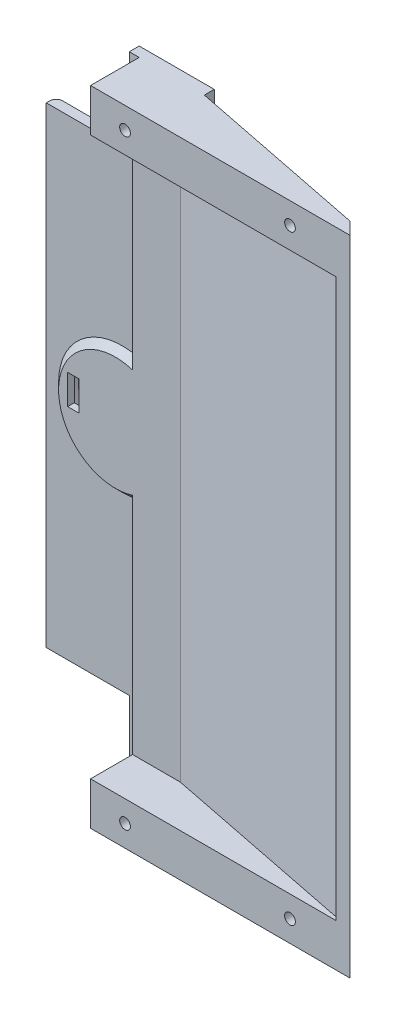
from build123d import *

# Parameters (mm, degrees)
CROQUIS1_W                 = 78.58
CROQUIS1_H                 = 17.74
SALIENTE_EXTRUIR1_DEPTH    = 195
CORTAR_EXTRUIR1_DEPTH      = 200.116501074
CORTAR_EXTRUIR1_DEPTH_BACK = 200.116501074
CHAFL_N1_SIZE2             = 3.821967962
CHAFL_N1_SIZE              = 3
CROQUIS4_W                 = 3
CROQUIS4_H                 = 195
SALIENTE_EXTRUIR2_DEPTH    = 3
CROQUIS5_W                 = 25.18
CROQUIS5_H                 = 143
SALIENTE_EXTRUIR3_DEPTH    = 3
REDONDEO1_R                = 2
CORTAR_EXTRUIR2_DEPTH      = 208.103617786
CORTAR_EXTRUIR2_DEPTH_BACK = 208.103617786
CROQUIS6_R                 = 1.625
CORTAR_EXTRUIR3_START      = -3
CROQUIS7_R                 = 3.5
CORTAR_EXTRUIR3_DEPTH      = 205.103617786
CROQUIS8_R                 = 16.25
CROQUIS8_R_2               = 8.75
CORTAR_EXTRUIR4_DEPTH      = 3
CROQUIS9_R                 = 17.25
SALIENTE_EXTRUIR4_DEPTH    = 2
CHAFL_N2_SIZE              = 2
CORTAR_EXTRUIR6_DEPTH      = 208.103617786
CORTAR_EXTRUIR6_DEPTH_BACK = 208.103617786
CROQUIS10_W                = 3.5
CROQUIS10_H                = 9
CORTAR_EXTRUIR7_DEPTH      = 1
CORTAR_EXTRUIR8_START      = -13
CORTAR_EXTRUIR8_DEPTH      = 169


with BuildPart() as part:
    # Croquis1 → Saliente-Extruir1 (new body)
    with BuildSketch(Plane(origin=(0, 0, 0), x_dir=(1, 0, 0), z_dir=(0, 1, 0))):
        Rectangle(CROQUIS1_W, CROQUIS1_H)
    extrude(amount=SALIENTE_EXTRUIR1_DEPTH)

    # Croquis2 → Cortar-Extruir1 (cut, two sides: drawn at the far end of the back side and taken through both)
    with BuildSketch(Plane.XZ.offset(-CORTAR_EXTRUIR1_DEPTH_BACK)):
        Polygon((39.29, 5.87), (-19.532543769, -5.87), (-19.532543769, -8.87), (39.29, -8.87), align=None)
    extrude(amount=CORTAR_EXTRUIR1_DEPTH + CORTAR_EXTRUIR1_DEPTH_BACK, mode=Mode.SUBTRACT)

    # Chaflán1
    chafl_n1_edges = [part.edges().sort_by_distance(p)[0] for p in [
        (39.29, 97.5, 5.87),
    ]]
    chafl_n1_side = [part.faces().sort_by_distance(p)[0] for p in [
        (39.29, 97.5, 5.93),
    ]]
    chamfer(chafl_n1_edges, length=CHAFL_N1_SIZE - 0.0001, length2=CHAFL_N1_SIZE2 - 0.0001, reference=chafl_n1_side[0])  # a hair under: the kernel refuses the full size

    # Croquis4 → Saliente-Extruir2 (add)
    with BuildSketch(Plane(origin=(0, 0, -8.87), x_dir=(-1, 0, 0), z_dir=(0, 0, -1))):
        with Locations((40.79, 97.5)):
            Rectangle(CROQUIS4_W, CROQUIS4_H)
    extrude(amount=-SALIENTE_EXTRUIR2_DEPTH)

    # Croquis5 → Saliente-Extruir3 (add)
    with BuildSketch(Plane(origin=(0, 0, -8.87), x_dir=(-1, 0, 0), z_dir=(0, 0, -1))):
        with Locations((54.88, 97.5)):
            Rectangle(CROQUIS5_W, CROQUIS5_H)
    extrude(amount=-SALIENTE_EXTRUIR3_DEPTH)

    # Redondeo1
    redondeo1_edges = [part.edges().sort_by_distance(p)[0] for p in [
        (-67.47, 97.5, -8.87),
    ]]
    fillet(redondeo1_edges, radius=REDONDEO1_R)

    # Croquis6 → Cortar-Extruir2 (cut, two sides: drawn at the far end of the back side and taken through both)
    with BuildSketch(Plane.XY.offset(8.87).offset(-CORTAR_EXTRUIR2_DEPTH_BACK)):
        with Locations((-28.84, 188.5)):
            Circle(CROQUIS6_R)
        with Locations((21.16, 188.5)):
            Circle(CROQUIS6_R)
        with Locations((21.16, 6.5)):
            Circle(CROQUIS6_R)
        with Locations(Location((-28.84, 6.5, 0), (0, 0, 180))):
            Circle(CROQUIS6_R)
    extrude(amount=CORTAR_EXTRUIR2_DEPTH + CORTAR_EXTRUIR2_DEPTH_BACK, mode=Mode.SUBTRACT)

    # Croquis7 → Cortar-Extruir3 (cut, through all)
    with BuildSketch(Plane.XY.offset(8.87).offset(CORTAR_EXTRUIR3_START)):
        with Locations((-28.84, 188.5)):
            Circle(CROQUIS7_R)
        with Locations((21.16, 188.5)):
            Circle(CROQUIS7_R)
        with Locations((-28.84, 6.5)):
            Circle(CROQUIS7_R)
        with Locations((21.16, 6.5)):
            Circle(CROQUIS7_R)
    extrude(amount=-CORTAR_EXTRUIR3_DEPTH, mode=Mode.SUBTRACT)

    # Croquis8 → Cortar-Extruir4 (cut)
    with BuildSketch(Plane(origin=(0, 0, -8.87), x_dir=(-1, 0, 0), z_dir=(0, 0, -1))):
        with Locations((44.469949206, 97.5)):
            Circle(CROQUIS8_R)
        with Locations((44.469949206, 97.5)):
            Circle(CROQUIS8_R_2, mode=Mode.SUBTRACT)
    extrude(amount=-CORTAR_EXTRUIR4_DEPTH, mode=Mode.SUBTRACT)

    # Croquis9 → Saliente-Extruir4 (add)
    with BuildSketch(Plane.XY.offset(-5.87)):
        with Locations((-44.469949206, 97.5)):
            Circle(CROQUIS9_R)
    extrude(amount=SALIENTE_EXTRUIR4_DEPTH)

    # Chaflán2
    chafl_n2_edges = [part.edges().sort_by_distance(p)[0] for p in [
        (-61.719949206, 97.5, -5.87),
    ]]
    chamfer(chafl_n2_edges, length=CHAFL_N2_SIZE - 0.0001)  # a hair under: the kernel refuses the full size

    # Croquis10 → Cortar-Extruir6 (cut, two sides: drawn at the far end of the back side and taken through both)
    with BuildSketch(Plane(origin=(0, 0, -8.87), x_dir=(-1, 0, 0), z_dir=(0, 0, -1)).offset(-CORTAR_EXTRUIR6_DEPTH_BACK)):
        with Locations((57.22, 99)):
            Rectangle(CROQUIS10_W, CROQUIS10_H)
    extrude(amount=CORTAR_EXTRUIR6_DEPTH + CORTAR_EXTRUIR6_DEPTH_BACK, mode=Mode.SUBTRACT)

    # Croquis11 → Cortar-Extruir7 (cut)
    with BuildSketch(Plane(origin=(0.378430223, 0, -1.896101224), x_dir=(-0.9806591733939511, 0, -0.1957232373487947), z_dir=(0.19572323734879468, 0, -0.980659173393951))):
        Polygon((-28.864838216, 97.5), (-15.458781877, 92.947300595), (-7.58538371, 97.5), (-15.458781877, 102.052699405), align=None)
        Polygon((-10.689272405, 88.750905342), (-6.961025568, 83.426417054), (-14.813228871, 81.895762524), align=None)
        Polygon((-8.5598171, 92.683515176), (-1.676899864, 82.853690645), (9.381652734, 90.596972535), (4.548100867, 97.5), (9.381652734, 104.403027465), (-1.676899864, 112.146309355), (-8.5598171, 102.316484824), (-2.496901935, 106.616608043), (2.418010331, 103.175149425), (-1.555772077, 97.5), (2.418010331, 91.824850575), (-2.496901935, 88.383391957), align=None)
        Polygon((7.048100867, 97.5), (9.548100867, 95), (14.008259291, 97.5), (9.548100867, 100), align=None)
        Polygon((-14.813228871, 113.104237476), (-10.689272405, 106.249094658), (-6.961025568, 111.573582946), align=None)
    extrude(amount=-CORTAR_EXTRUIR7_DEPTH, mode=Mode.SUBTRACT)

    # Croquis12 → Cortar-Extruir8 (cut)
    with BuildSketch(Plane.XZ.offset(CORTAR_EXTRUIR8_START)):
        Polygon((-20.119713481, -2.92802248), (-24.839433576, -3.87), (-39.29, -3.87), (-39.29, 8.87), (35.047359313, 8.87), (34.063379787, 7.886020474), align=None)
    extrude(amount=-CORTAR_EXTRUIR8_DEPTH, mode=Mode.SUBTRACT)


solid = part.part
